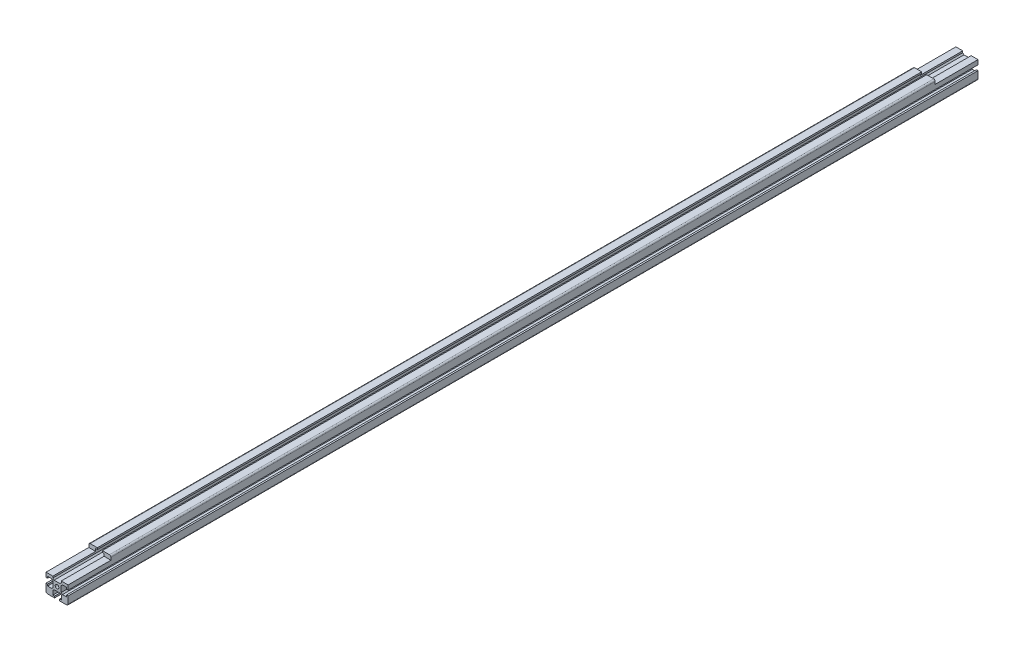
from build123d import *

# Parameters (mm, degrees)
SKETCH1_R           = 1.25
BOSS_EXTRUDE1_DEPTH = 616.81
FILLET1_R           = 1
SKETCH2_W           = 15
SKETCH2_H           = 29.01
CUT_EXTRUDE2_DEPTH  = 2.74
SKETCH3_W           = 15
SKETCH3_H           = 29.01
CUT_EXTRUDE3_DEPTH  = 2.74


with BuildPart() as part:
    # Sketch1 → Boss-Extrude1 (new body)
    with BuildSketch(Plane.XY):
        Polygon((7.5, -7.5), (1.7, -7.5), (1.7, -6.4), (2.85, -6.4), (2.85, -3.63183498), (2.01816502, -2.8), (-2.01816502, -2.8), (-2.85, -3.63183498), (-2.85, -6.4), (-1.7, -6.4), (-1.7, -7.5), (-7.5, -7.5), (-7.5, -1.7), (-6.4, -1.7), (-6.4, -2.85), (-3.63183498, -2.85), (-2.8, -2.01816502), (-2.8, 2.01816502), (-3.63183498, 2.85), (-6.4, 2.85), (-6.4, 1.7), (-7.5, 1.7), (-7.5, 7.5), (-1.7, 7.5), (-1.7, 6.4), (-2.85, 6.4), (-2.85, 3.63183498), (-2.01816502, 2.8), (2.01816502, 2.8), (2.85, 3.63183498), (2.85, 6.4), (1.7, 6.4), (1.7, 7.5), (7.5, 7.5), (7.5, 1.7), (6.4, 1.7), (6.4, 2.85), (3.63183498, 2.85), (2.8, 2.01816502), (2.8, -2.01816502), (3.63183498, -2.85), (6.4, -2.85), (6.4, -1.7), (7.5, -1.7), align=None)
        Circle(SKETCH1_R, mode=Mode.SUBTRACT)
    extrude(amount=BOSS_EXTRUDE1_DEPTH)

    # Fillet1
    fillet1_edges = [part.edges().sort_by_distance(p)[0] for p in [
        (7.5, -7.5, 308.405),
        (-7.5, -7.5, 308.405),
        (7.5, 7.5, 308.405),
        (-7.5, 7.5, 308.405),
    ]]
    fillet(fillet1_edges, radius=FILLET1_R)

    # Sketch2 → Cut-Extrude2 (cut)
    with BuildSketch(Plane(origin=(0, 7.5, 0), x_dir=(1, 0, 0), z_dir=(0, 1, 0))):
        with Locations((0, -602.305)):
            Rectangle(SKETCH2_W, SKETCH2_H)
    extrude(amount=-CUT_EXTRUDE2_DEPTH, mode=Mode.SUBTRACT)

    # Sketch3 → Cut-Extrude3 (cut)
    with BuildSketch(Plane(origin=(0, 7.5, 0), x_dir=(1, 0, 0), z_dir=(0, 1, 0))):
        with Locations((0, -14.505)):
            Rectangle(SKETCH3_W, SKETCH3_H)
    extrude(amount=-CUT_EXTRUDE3_DEPTH, mode=Mode.SUBTRACT)


solid = part.part
